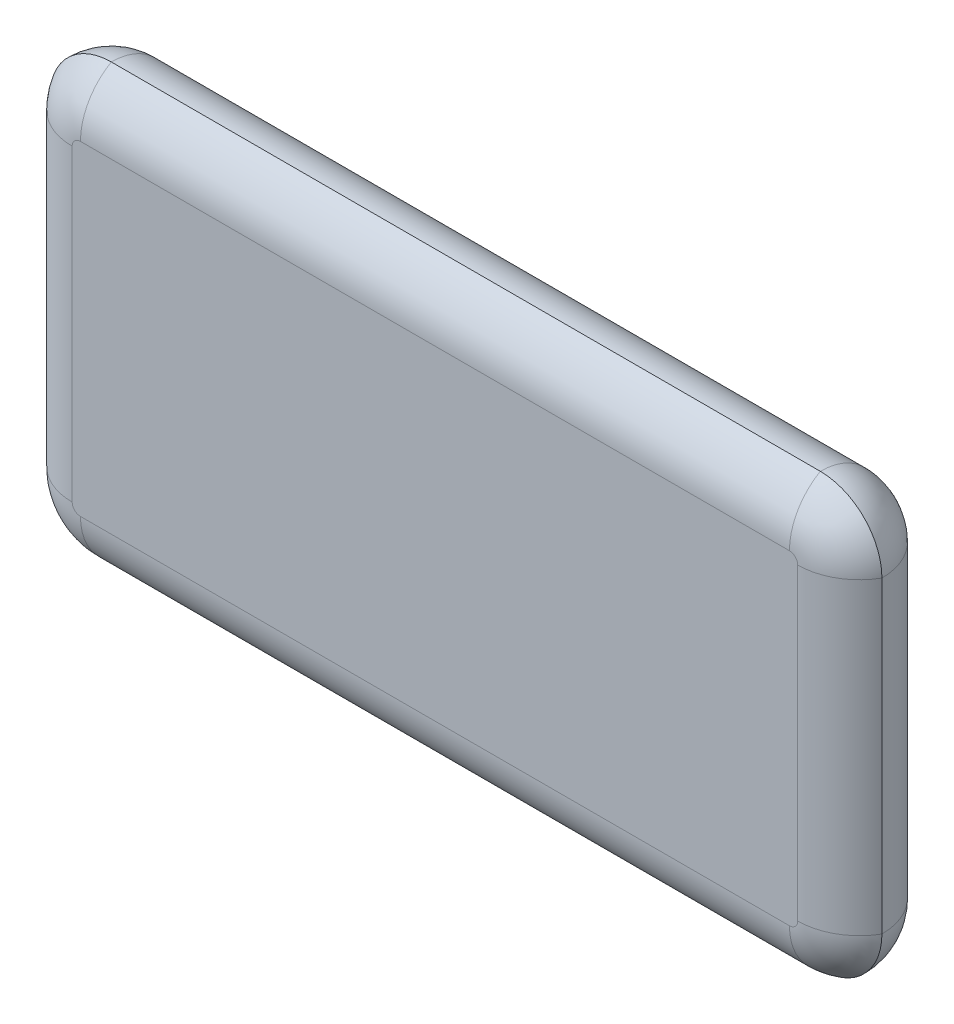
from build123d import *

# Parameters (mm, degrees)
SKETCH1_W           = 135
SKETCH1_H           = 70
BOSS_EXTRUDE1_DEPTH = 15
FILLET2_R           = 10
FILLET3_R           = 10
FILLET4_R           = 10
FILLET5_R           = 10
FILLET12_R          = 10
FILLET13_R          = 10


with BuildPart() as part:
    # Sketch1 → Boss-Extrude1 (new body)
    with BuildSketch(Plane.XY):
        with Locations((18.404407689, 12.303703611)):
            Rectangle(SKETCH1_W, SKETCH1_H)
    extrude(amount=BOSS_EXTRUDE1_DEPTH)

    # Fillet2
    fillet2_edges = [part.edges().sort_by_distance(p)[0] for p in [
        (-49.095592311, -22.696296389, 7.5),
    ]]
    fillet(fillet2_edges, radius=FILLET2_R)

    # Fillet3
    fillet3_edges = [part.edges().sort_by_distance(p)[0] for p in [
        (-49.095592311, 47.303703611, 7.5),
    ]]
    fillet(fillet3_edges, radius=FILLET3_R)

    # Fillet4
    fillet4_edges = [part.edges().sort_by_distance(p)[0] for p in [
        (85.904407689, 47.303703611, 7.5),
    ]]
    fillet(fillet4_edges, radius=FILLET4_R)

    # Fillet5
    fillet5_edges = [part.edges().sort_by_distance(p)[0] for p in [
        (85.904407689, -22.696296389, 7.5),
    ]]
    fillet(fillet5_edges, radius=FILLET5_R)

    # Fillet12
    fillet12_edges = [part.edges().sort_by_distance(p)[0] for p in [
        (18.404407689, -22.696296389, 0),
        (-46.166660123, -19.7673642, 0),
        (-49.095592311, 12.303703611, 0),
        (-46.166660123, 44.374771423, 0),
        (18.404407689, 47.303703611, 0),
        (82.975475501, 44.374771423, 0),
        (85.904407689, 12.303703611, 0),
        (82.975475501, -19.7673642, 0),
    ]]
    fillet(fillet12_edges, radius=FILLET12_R)

    # Fillet13
    # the kernel refuses this fillet: 10 mm, written as the material it takes off along each edge
    with BuildSketch(Plane(origin=(75.904407689, 37.303703611, 15), x_dir=(0, 1, 0), z_dir=(-1, 0, 0))) as fillet13_piece_1:
        with BuildLine():
            CenterArc((1.339745962, 10), FILLET13_R, 270, 60)
            Line((10, 5), (10.173205081, 4.9))
            ThreePointArc((10.173205081, 4.9), (10.2, 2.5), (10.2, 0))
            Line((10.2, 0), (10, -0.2))
            Line((10, -0.2), (1.339745962, -0.2))
            Line((1.339745962, -0.2), (1.339745962, 0))
        make_face()
    revolve(axis=Axis((75.904407689, 37.303703611, 15), (0, 0, -1)), revolution_arc=90, mode=Mode.SUBTRACT)
    with BuildSketch(Plane(origin=(75.904407689, -12.696296389, 15), x_dir=(1, 0, 0), z_dir=(0, 1, 0))) as fillet13_piece_2:
        with BuildLine():
            CenterArc((1.339745962, 10), FILLET13_R, 270, 60)
            Line((1.339745962, 0), (1.339745962, -0.2))
            Line((1.339745962, -0.2), (10, -0.2))
            Line((10, -0.2), (10.2, 0))
            ThreePointArc((10.2, 0), (10.2, 2.5), (10.173205081, 4.9))
            Line((10.173205081, 4.9), (10, 5))
        make_face()
    revolve(axis=Axis((75.904407689, -12.696296389, 15), (0, 0, -1)), revolution_arc=90, mode=Mode.SUBTRACT)
    with BuildSketch(Plane(origin=(-39.095592311, -12.696296389, 15), x_dir=(0, -1, 0), z_dir=(1, 0, 0))) as fillet13_piece_3:
        with BuildLine():
            CenterArc((1.339745962, 10), FILLET13_R, 270, 60)
            Line((10, 5), (10.173205081, 4.9))
            ThreePointArc((10.173205081, 4.9), (10.2, 2.5), (10.2, 0))
            Line((10.2, 0), (10, -0.2))
            Line((10, -0.2), (1.339745962, -0.2))
            Line((1.339745962, -0.2), (1.339745962, 0))
        make_face()
    revolve(axis=Axis((-39.095592311, -12.696296389, 15), (0, 0, -1)), revolution_arc=90, mode=Mode.SUBTRACT)
    with BuildSketch(Plane(origin=(-39.095592311, 37.303703611, 15), x_dir=(-1, 0, 0), z_dir=(0, -1, 0))) as fillet13_piece_4:
        with BuildLine():
            CenterArc((1.339745962, 10), FILLET13_R, 270, 60)
            Line((10, 5), (10.173205081, 4.9))
            ThreePointArc((10.173205081, 4.9), (10.2, 2.5), (10.2, 0))
            Line((10.2, 0), (10, -0.2))
            Line((10, -0.2), (1.339745962, -0.2))
            Line((1.339745962, -0.2), (1.339745962, 0))
        make_face()
    revolve(axis=Axis((-39.095592311, 37.303703611, 15), (0, 0, -1)), revolution_arc=90, mode=Mode.SUBTRACT)
    with BuildSketch(Plane(origin=(-49.095592311, -12.696296389, 15), x_dir=(0, 0, -1), z_dir=(0, 1, 0)), Plane(origin=(85.904407689, 37.303703611, 15), x_dir=(0, 0, -1), z_dir=(0, -1, 0))) as fillet13_piece_5:
        with BuildLine():
            CenterArc((10, -8.660254038), FILLET13_R, 120, 60)
            Line((0, -8.660254038), (-0.2, -8.660254038))
            Line((-0.2, -8.660254038), (-0.2, 0))
            Line((-0.2, 0), (0, 0.2))
            ThreePointArc((0, 0.2), (2.5, 0.2), (4.9, 0.173205081))
            Line((4.9, 0.173205081), (5, 0))
        make_face()
    extrude(amount=50, mode=Mode.SUBTRACT)
    with BuildSketch(Plane(origin=(75.904407689, -22.696296389, 15), x_dir=(0, 0, -1), z_dir=(-1, 0, 0)), Plane(origin=(-39.095592311, 47.303703611, 15), x_dir=(0, 0, -1), z_dir=(1, 0, 0))) as fillet13_piece_6:
        with BuildLine():
            CenterArc((10, -8.660254038), FILLET13_R, 120, 60)
            Line((0, -8.660254038), (-0.2, -8.660254038))
            Line((-0.2, -8.660254038), (-0.2, 0))
            Line((-0.2, 0), (0, 0.2))
            ThreePointArc((0, 0.2), (2.5, 0.2), (4.9, 0.173205081))
            Line((4.9, 0.173205081), (5, 0))
        make_face()
    extrude(amount=115, mode=Mode.SUBTRACT)


solid = part.part
